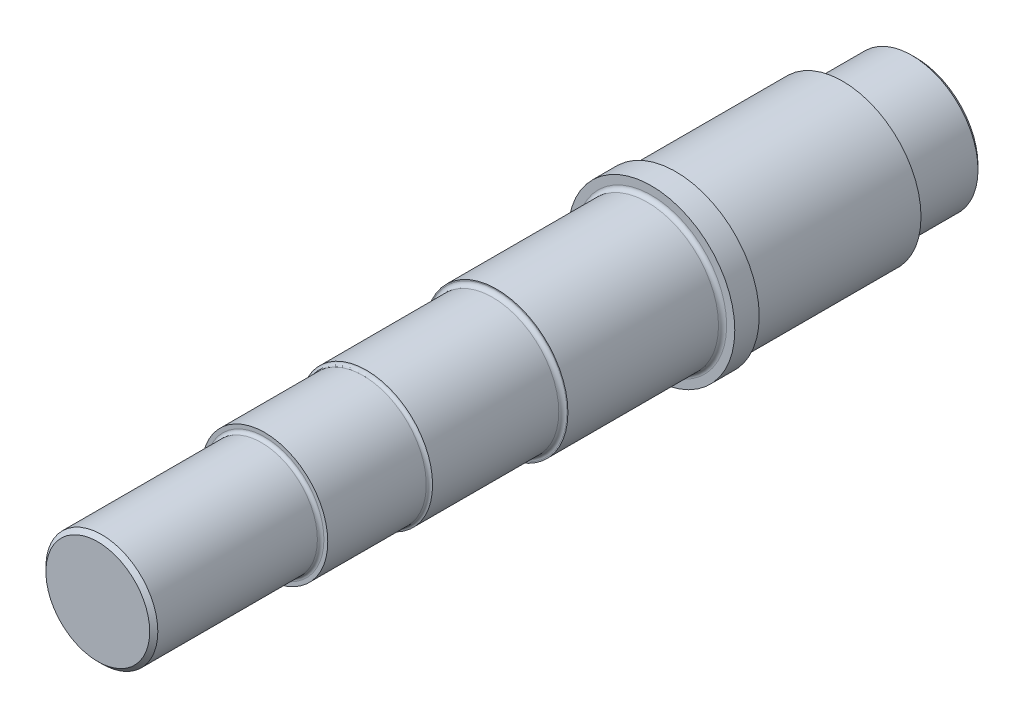
from build123d import *

# Parameters (mm, degrees)
SKETCH_1_R      = 32.5
EXTRUDE_1_DEPTH = 36
SKETCH_2_R      = 38.5
EXTRUDE_2_DEPTH = 82
SKETCH_3_R      = 41
EXTRUDE_3_DEPTH = 12
SKETCH_4_R      = 35
EXTRUDE_4_DEPTH = 76
SKETCH_5_R      = 32.5
EXTRUDE_5_DEPTH = 64
SKETCH_6_R      = 31
EXTRUDE_6_DEPTH = 50
SKETCH_7_R      = 27.5
EXTRUDE_7_DEPTH = 82
FILLET_1_R      = 2
FILLET_2_R      = 1.6
CHAMFER_1_SIZE  = 2


with BuildPart() as part:
    # 草图1 → 凸台-拉伸1 (new body)
    with BuildSketch(Plane.XY):
        Circle(SKETCH_1_R)
    extrude(amount=EXTRUDE_1_DEPTH)

    # 草图2 → 凸台-拉伸2 (add)
    with BuildSketch(Plane.XY.offset(36)):
        Circle(SKETCH_2_R)
    extrude(amount=EXTRUDE_2_DEPTH)

    # 草图3 → 凸台-拉伸3 (add)
    with BuildSketch(Plane.XY.offset(118)):
        Circle(SKETCH_3_R)
    extrude(amount=EXTRUDE_3_DEPTH)

    # 草图4 → 凸台-拉伸4 (add)
    with BuildSketch(Plane.XY.offset(130)):
        Circle(SKETCH_4_R)
    extrude(amount=EXTRUDE_4_DEPTH)

    # 草图5 → 凸台-拉伸5 (add)
    with BuildSketch(Plane.XY.offset(206)):
        Circle(SKETCH_5_R)
    extrude(amount=EXTRUDE_5_DEPTH)

    # 草图6 → 凸台-拉伸6 (add)
    with BuildSketch(Plane.XY.offset(270)):
        Circle(SKETCH_6_R)
    extrude(amount=EXTRUDE_6_DEPTH)

    # 草图7 → 凸台-拉伸7 (add)
    with BuildSketch(Plane.XY.offset(320)):
        Circle(SKETCH_7_R)
    extrude(amount=EXTRUDE_7_DEPTH)

    # 圆角1
    fillet_1_edges = [part.edges().sort_by_distance(p)[0] for p in [
        (-35, 0, 130),
        (-32.5, 0, 206),
    ]]
    fillet(fillet_1_edges, radius=FILLET_1_R)

    # 圆角2
    # the kernel refuses this fillet: 1.6 mm, written as the material it adds along each edge
    with BuildSketch(Plane(origin=(0, 0, 270), x_dir=(1, 0, 0), z_dir=(0, -1, 0))) as fillet_2_piece_1:
        with BuildLine():
            CenterArc((32.6, 1.596871942), FILLET_2_R, 180, 86.416678302)
            Line((31, 1.596871942), (30.968, 1.596871942))
            Line((30.968, 1.596871942), (30.968, 0))
            Line((30.968, 0), (31, -0.032))
            ThreePointArc((31, -0.032), (31.75, -0.032), (32.498, -0.031937439))
            Line((32.498, -0.031937439), (32.5, 0))
        make_face()
    revolve(axis=Axis((0, 0, 270), (0, 0, 1)))
    with BuildSketch(Plane(origin=(0, 0, 320), x_dir=(1, 0, 0), z_dir=(0, -1, 0))) as fillet_2_piece_2:
        with BuildLine():
            CenterArc((27.5 + FILLET_2_R, FILLET_2_R), FILLET_2_R, 180, 90)
            Line((27.5, FILLET_2_R), (27.5 - FILLET_2_R * 0.02, FILLET_2_R))
            Line((27.5 - FILLET_2_R * 0.02, FILLET_2_R), (27.5 - FILLET_2_R * 0.02, -FILLET_2_R * 0.02))
            Line((27.5 - FILLET_2_R * 0.02, -FILLET_2_R * 0.02), (27.5 + FILLET_2_R, -FILLET_2_R * 0.02))
            Line((27.5 + FILLET_2_R, -FILLET_2_R * 0.02), (27.5 + FILLET_2_R, 0))
        make_face()
    revolve(axis=Axis((0, 0, 320), (0, 0, 1)))

    # 倒角1
    chamfer_1_edges = [part.edges().sort_by_distance(p)[0] for p in [
        (-32.5, 0, 0),
        (-27.5, 0, 402),
    ]]
    chamfer(chamfer_1_edges, length=CHAMFER_1_SIZE)


solid = part.part
